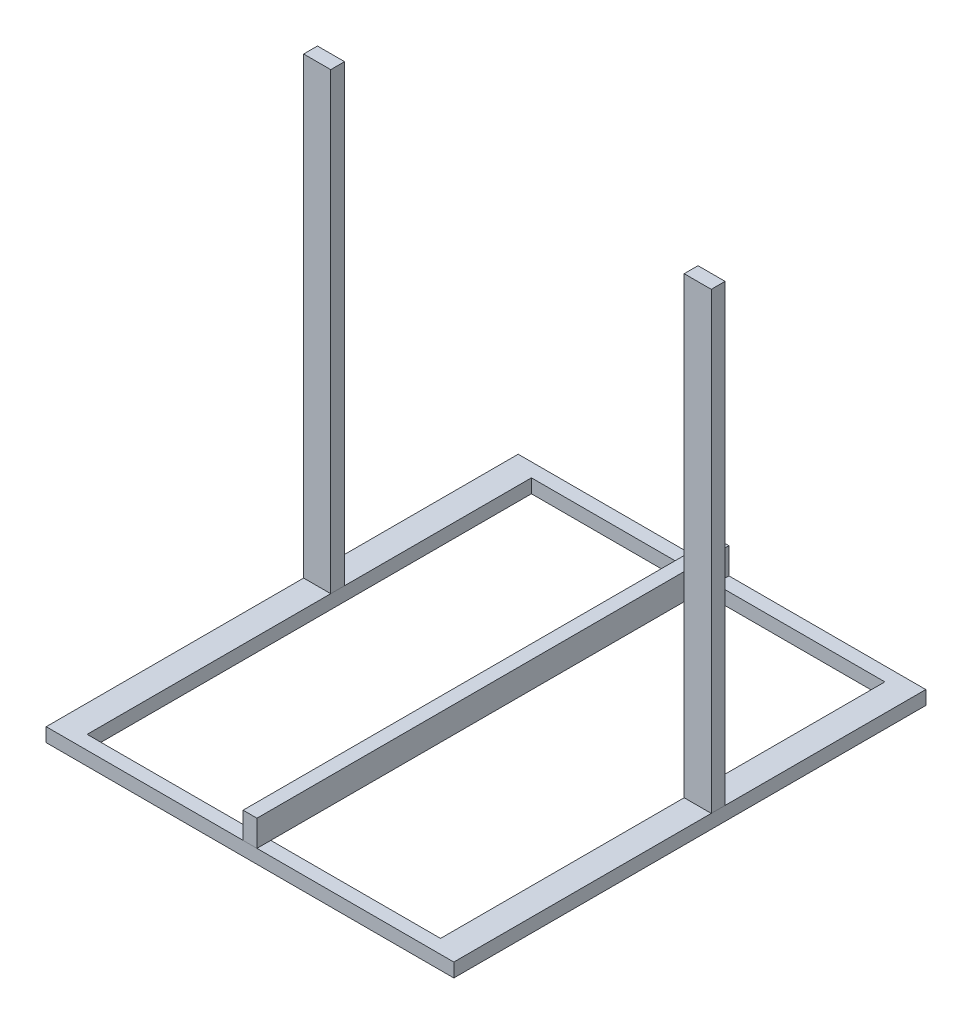
from build123d import *

# Parameters (mm, degrees)
SKETCH1_W           = 603.25
SKETCH1_H           = 698.5
SKETCH1_W_2         = 523.05
SKETCH1_H_2         = 657.56
BOSS_EXTRUDE1_DEPTH = 20.47
SKETCH2_W           = 40.1
SKETCH2_H           = 20.47
BOSS_EXTRUDE2_DEPTH = 671.68
SKETCH3_W           = 20.54
SKETCH3_H           = 698.5
BOSS_EXTRUDE3_DEPTH = 38.67


with BuildPart() as part:
    # Sketch1 → Boss-Extrude1 (new body)
    with BuildSketch(Plane(origin=(0, 0, 0), x_dir=(1, 0, 0), z_dir=(0, 1, 0))):
        Rectangle(SKETCH1_W, SKETCH1_H)
        Rectangle(SKETCH1_W_2, SKETCH1_H_2, mode=Mode.SUBTRACT)
    extrude(amount=BOSS_EXTRUDE1_DEPTH)

    # Sketch2 → Boss-Extrude2 (add)
    with BuildSketch(Plane(origin=(0, 20.47, 0), x_dir=(1, 0, 0), z_dir=(0, 1, 0))):
        with Locations((-281.575, 41.985)):
            Rectangle(SKETCH2_W, SKETCH2_H)
        with Locations((281.575, 41.985)):
            Rectangle(SKETCH2_W, SKETCH2_H)
    extrude(amount=BOSS_EXTRUDE2_DEPTH)

    # Sketch3 → Boss-Extrude3 (add)
    with BuildSketch(Plane(origin=(0, 20.47, 0), x_dir=(1, 0, 0), z_dir=(0, 1, 0))):
        Rectangle(SKETCH3_W, SKETCH3_H)
    extrude(amount=BOSS_EXTRUDE3_DEPTH)


with BuildPart() as body_2:
    # Split1: the piece on the far side of the plane
    add(part.part)
    split(bisect_by=Plane(origin=(0, 20.47, 0), x_dir=(0, 0, -1), z_dir=(0, -1, 0)), keep=Keep.BOTTOM)


with BuildPart() as part_1:
    add(part.part)

    # Split1
    split(bisect_by=Plane(origin=(0, 20.47, 0), x_dir=(0, 0, -1), z_dir=(0, -1, 0)), keep=Keep.TOP)


solid = Compound([body_2.part, part_1.part])
